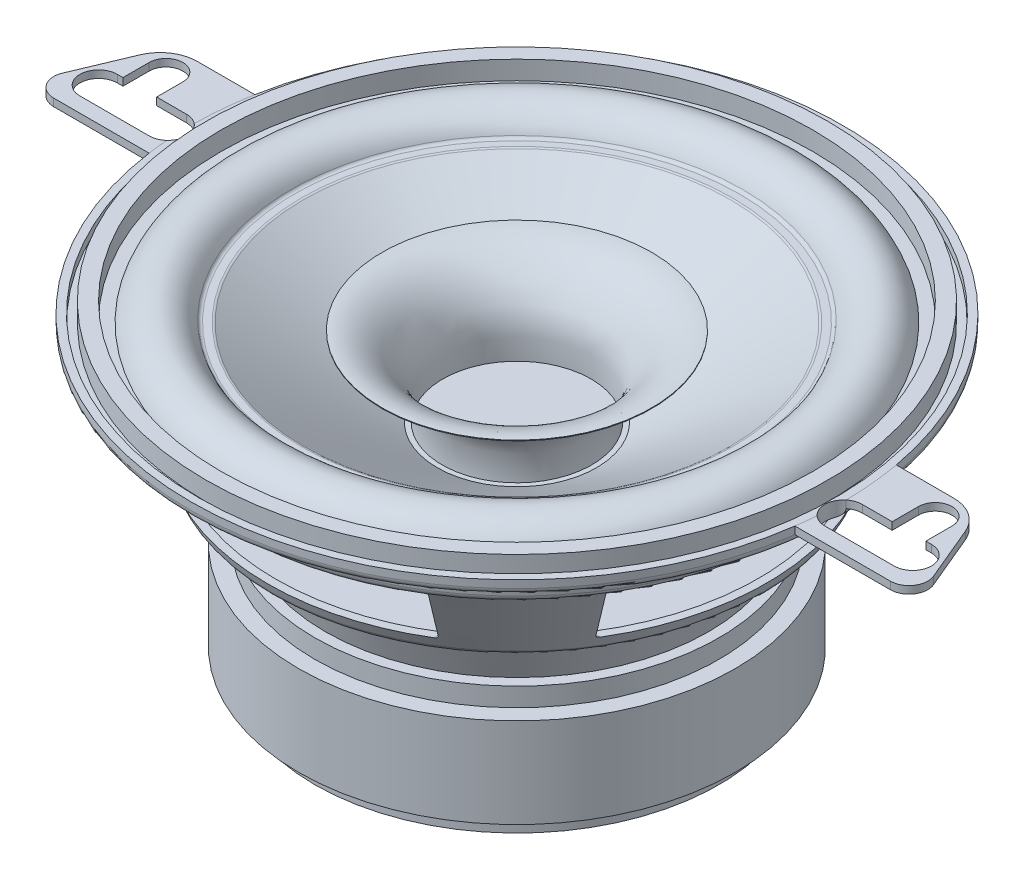
from build123d import *

# Parameters (mm, degrees)
SKETCH1_R                = 29.15
BOSS_EXTRUDE1_DEPTH      = 12
BOSS_EXTRUDE2_DEPTH      = 2.5
BOSS_EXTRUDE2_DEPTH_BACK = 14.5
SKETCH2_R                = 27
SKETCH3_R                = 25.6
SKETCH4_R                = 28
SKETCH5_R                = 32.5
SKETCH6_R                = 36.75
SKETCH7_R                = 38.25
SKETCH9_R                = 38.6
SKETCH10_R               = 43.5
SKETCH11_R               = 43.55
SHELL2_T                 = -1
SKETCH12_R               = 30
BOSS_EXTRUDE5_DEPTH      = 0.1
CUT_EXTRUDE1_DEPTH       = 73.632327686
CUT_EXTRUDE1_DEPTH_BACK  = 73.632327686
CUT_EXTRUDE2_DEPTH       = 73.632327686
CUT_EXTRUDE2_DEPTH_BACK  = 73.632327686
SKETCH15_R               = 12.5
BOSS_EXTRUDE6_DEPTH      = 3
SKETCH21_R               = 41.524687549
SKETCH21_R_2             = 39.524687549
BOSS_EXTRUDE7_DEPTH      = 2.5
FILLET2_R                = 1
FILLET3_R                = 0.5
FILLET4_R                = 0.5
BOSS_EXTRUDE9_DEPTH      = 1
BOSS_EXTRUDE9_2_DEPTH    = 1
CUT_EXTRUDE4_DEPTH       = 41


# Read off the part's stored shape, not the designer's step: Loft-Thin1, Revolve-Thin7
with BuildPart() as part:
    # Sketch1 → Boss-Extrude1 (new body)
    with BuildSketch(Plane(origin=(0, 0, 0), x_dir=(1, 0, 0), z_dir=(0, 1, 0))):
        with Locations(Location((0, 0, 0), (0, 0, 270))):
            Circle(SKETCH1_R)
    extrude(amount=BOSS_EXTRUDE1_DEPTH)

    # Sketch2 → Boss-Extrude2 (add, two sides: drawn at the far end of the back side and taken through both)
    with BuildSketch(Plane(origin=(0, 0, 0), x_dir=(-1, 0, 0), z_dir=(0, -1, 0)).offset(-BOSS_EXTRUDE2_DEPTH_BACK)):
        with Locations(Location((0, 0, 0), (0, 0, 90))):
            Circle(SKETCH2_R)
    extrude(amount=BOSS_EXTRUDE2_DEPTH + BOSS_EXTRUDE2_DEPTH_BACK)

    # Sketch3 → Loft2 section 0
    with BuildSketch(Plane(origin=(0, 14.5, 0), x_dir=(1, 0, 0), z_dir=(0, 1, 0))):
        Circle(SKETCH3_R)
    # Sketch4 → Loft2 section 1
    with BuildSketch(Plane(origin=(0, 22, 0), x_dir=(1, 0, 0), z_dir=(0, 1, 0))):
        Circle(SKETCH4_R)
    loft()

    # Sketch5 → Loft3 section 0
    with BuildSketch(Plane(origin=(0, 22, 0), x_dir=(1, 0, 0), z_dir=(0, 1, 0))):
        Circle(SKETCH5_R)
    # Sketch6 → Loft3 section 1
    with BuildSketch(Plane(origin=(0, 32, 0), x_dir=(1, 0, 0), z_dir=(0, 1, 0))):
        Circle(SKETCH6_R)
    loft()

    # Sketch7 → Loft5 section 0
    with BuildSketch(Plane(origin=(0, 32, 0), x_dir=(1, 0, 0), z_dir=(0, 1, 0))):
        Circle(SKETCH7_R)
    # Sketch9 → Loft5 section 1
    with BuildSketch(Plane(origin=(0, 36.5, 0), x_dir=(1, 0, 0), z_dir=(0, 1, 0))):
        Circle(SKETCH9_R)
    loft()

    # Sketch10 → Loft6 section 0
    with BuildSketch(Plane(origin=(0, 36.5, 0), x_dir=(1, 0, 0), z_dir=(0, 1, 0))):
        Circle(SKETCH10_R)
    # Sketch11 → Loft6 section 1
    with BuildSketch(Plane(origin=(0, 38.5, 0), x_dir=(1, 0, 0), z_dir=(0, 1, 0))):
        Circle(SKETCH11_R)
    loft()

    # Shell2
    shell2_openings = [part.faces().sort_by_distance(p)[0] for p in [
        (0, 38.5, 0),
    ]]
    offset(amount=SHELL2_T, openings=shell2_openings, kind=Kind.INTERSECTION)

    # Sketch12 → Boss-Extrude5 (add)
    with BuildSketch(Plane(origin=(0, 23, 0), x_dir=(1, 0, 0), z_dir=(0, 1, 0))):
        Circle(SKETCH12_R)
    extrude(amount=-BOSS_EXTRUDE5_DEPTH)

    # Sketch13 → Cut-Extrude1 (cut, two sides: drawn at the far end of the back side and taken through both)
    with BuildSketch(Plane.XY.offset(-CUT_EXTRUDE1_DEPTH_BACK)):
        Polygon((-19.249950175, 31.9), (19.250049825, 31.9), (17.75, 23.9), (-17.75, 23.9), align=None)
    extrude(amount=CUT_EXTRUDE1_DEPTH + CUT_EXTRUDE1_DEPTH_BACK, mode=Mode.SUBTRACT)

    # Sketch14 → Cut-Extrude2 (cut, two sides: drawn at the far end of the back side and taken through both)
    with BuildSketch(Plane(origin=(0, 0, 0), x_dir=(0, 0, -1), z_dir=(1, 0, 0)).offset(-CUT_EXTRUDE2_DEPTH_BACK)):
        Polygon((19.25, 32), (-19.25, 32), (-17.75, 23.992550499), (17.75, 23.992550499), align=None)
    extrude(amount=CUT_EXTRUDE2_DEPTH + CUT_EXTRUDE2_DEPTH_BACK, mode=Mode.SUBTRACT)

    # Sketch15 → Boss-Extrude6 (add)
    with BuildSketch(Plane(origin=(0, 23, 0), x_dir=(1, 0, 0), z_dir=(0, 1, 0))):
        with Locations(Location((0, 0, 0), (0, 0, 270))):
            Circle(SKETCH15_R)
    extrude(amount=BOSS_EXTRUDE6_DEPTH)

    # Loft-Thin1 outline → Loft-Thin1 (revolve)
    with BuildSketch(Plane.XY):
        Polygon((30.5, 37.5), (28.642607881, 37.5), (10.642607881, 26), (12.5, 26), align=None)
    revolve(axis=Axis((0, 0, 0), (0, 1, 0)))

    # Sketch20 → Revolve-Thin6 (revolve)
    with BuildSketch(Plane.XY, mode=Mode.PRIVATE) as revolve_thin6_sk:
        with BuildLine():
            Line((-38, 37.4), (-30, 37.4))
            ThreePointArc((-30, 37.4), (-34, 40.213859338), (-38, 37.4))
        make_face()
        with BuildLine():
            Line((-36.151213303, 38.4), (-31.848786697, 38.4))
            ThreePointArc((-31.848786697, 38.4), (-34, 39.213859338), (-36.151213303, 38.4))
        make_face(mode=Mode.SUBTRACT)
    revolve(revolve_thin6_sk.sketch.rotate(Axis((0, 0, 0), (0, 1, 0)), 90), axis=Axis((0, 0, 0), (0, 1, 0)))

    # Sketch21 → Boss-Extrude7 (add)
    with BuildSketch(Plane(origin=(0, 37.5, 0), x_dir=(1, 0, 0), z_dir=(0, 1, 0))):
        with Locations(Location((0, 0, 0), (0, 0, 270))):
            Circle(SKETCH21_R)
        with Locations(Location((0, 0, 0), (0, 0, 270))):
            Circle(SKETCH21_R_2, mode=Mode.SUBTRACT)
    extrude(amount=BOSS_EXTRUDE7_DEPTH)

    # Revolve-Thin7 outline → Revolve-Thin7 (revolve)
    with BuildSketch(Plane.XY):
        with BuildLine():
            Line((9.900002578, 26), (10, 26))
            add(Edge.make_bspline(
                [(10, 26), (9.999997357, 26.000033228), (9.979696301, 28.697563402), (10.344834904, 32.224034388), (14.21730858, 36.304403959), (17.337023546, 36.5)],
                knots=[0, 0, 0, 0, 0.092070554, 0.341498093, 0.956740448, 0.956740448, 0.956740448, 0.956740448], degree=3))
            Line((17.337023546, 36.5), (16.572693272, 36.5))
            add(Edge.make_bspline(
                [(9.900002578, 26), (9.899908304, 26.012548631), (9.899348237, 26.089593266), (9.898161356, 26.34489845), (9.897541657, 26.5302591), (9.897591072, 26.939692133), (9.89826009, 27.163713884), (9.902178573, 27.585720936), (9.905420042, 27.784839665), (9.930185733, 28.729445138), (9.977317516, 29.322446249), (10.131380394, 30.126403174), (10.196651744, 30.379981891), (10.36150456, 30.883390879), (10.46164346, 31.135262974), (10.817106934, 31.904413032), (11.125241489, 32.427659326), (12.22745905, 33.951606789), (13.199206623, 34.906845161), (15.018178688, 36.019293345), (15.778686052, 36.341128113), (16.572693272, 36.5)],
                knots=[0.002720303, 0.002720303, 0.002720303, 0.002720303, 0.03125, 0.03125, 0.0625, 0.0625, 0.09375, 0.09375, 0.125, 0.125, 0.25, 0.25, 0.3125, 0.3125, 0.375, 0.375, 0.5, 0.5, 0.75, 0.75, 0.907300699, 0.907300699, 0.907300699, 0.907300699], degree=3))
        make_face()
        with BuildLine():
            Line((16.572693272, 36.5), (17.337023546, 36.5))
            add(Edge.make_bspline(
                [(17.337023546, 36.5), (17.556380147, 36.51375295), (17.777537902, 36.514119108), (18, 36.5)],
                knots=[0.956740448, 0.956740448, 0.956740448, 0.956740448, 1, 1, 1, 1], degree=3))
            Line((18, 36.5), (18, 36.5997992))
            Line((18, 36.5997992), (17.330630327, 36.5997992))
            add(Edge.make_bspline(
                [(16.572693272, 36.5), (16.822282635, 36.549940016), (17.075182137, 36.583777582), (17.330630327, 36.5997992)],
                knots=[0.907300699, 0.907300699, 0.907300699, 0.907300699, 0.956746825, 0.956746825, 0.956746825, 0.956746825], degree=3))
        make_face()
        Polygon((18, 36.5997992), (18, 36.5), (18.006334003, 36.5997992), align=None)
        with BuildLine():
            Line((18, 36.5997992), (18.006334003, 36.5997992))
            add(Edge.make_bspline(
                [(18, 36.600197387), (18.002111209, 36.600065938), (18.004222544, 36.599933209), (18.006334003, 36.5997992)],
                knots=[0.999597402, 0.999597402, 0.999597402, 0.999597402, 1, 1, 1, 1], degree=3))
            Line((18, 36.600197387), (18, 36.5997992))
        make_face()
        with BuildLine():
            Line((17.330630327, 36.5997992), (18, 36.5997992))
            Line((18, 36.5997992), (18, 36.600197387))
            add(Edge.make_bspline(
                [(17.669483714, 36.610454275), (17.77927324, 36.610454278), (17.889464998, 36.607079563), (18, 36.600197387)],
                knots=[0.978518887, 0.978518887, 0.978518887, 0.978518887, 0.999597402, 0.999597402, 0.999597402, 0.999597402], degree=3))
            add(Edge.make_bspline(
                [(17.330630327, 36.5997992), (17.443108983, 36.60685382), (17.55608178, 36.610454272), (17.669483714, 36.610454275)],
                knots=[0.956746825, 0.956746825, 0.956746825, 0.956746825, 0.978518887, 0.978518887, 0.978518887, 0.978518887], degree=3))
        make_face()
    revolve(axis=Axis((0, 0, 0), (0, 1, 0)))

    # Fillet2
    fillet2_edges = [part.edges().sort_by_distance(p)[0] for p in [
        (-28, 22, 0),
        (-32.5, 22, 0),
        (-38.6, 36.5, 0),
        (-38.25, 32, 0),
        (-43.5, 36.5, 0),
    ]]
    fillet(fillet2_edges, radius=FILLET2_R)

    # Fillet3
    fillet3_edges = [part.edges().sort_by_distance(p)[0] for p in [
        (30.663455547, 32, 19.25),
        (-30.663455547, 32, 19.25),
        (30.663455547, 32, -19.25),
        (-30.663455547, 32, -19.25),
        (-27.584202046, 23.992550499, -17.75),
        (27.584202046, 23.992550499, -17.75),
        (-27.584202046, 23.992550499, 17.75),
        (27.584202046, 23.992550499, 17.75),
        (-19.249950175, 31.9, 30.613285978),
        (-19.249950175, 31.9, -30.613285978),
        (-17.75, 23.9, 27.537406311),
        (-17.75, 23.9, -27.537406311),
        (19.250049825, 31.9, -30.61322329),
        (19.250049825, 31.9, 30.61322329),
        (17.75, 23.9, -27.537406311),
        (17.75, 23.9, 27.537406311),
    ]]
    fillet(fillet3_edges, radius=FILLET3_R)

    # Fillet4
    fillet4_edges = [part.edges().sort_by_distance(p)[0] for p in [
        (-28.642607881, 37.5, 0),
        (0, 37.5, -30.037327686),
    ]]
    fillet(fillet4_edges, radius=FILLET4_R)


with BuildPart() as body_2:
    # Sketch25 → Boss-Extrude9 (new body)
    with BuildSketch(Plane(origin=(0, 38.5, 0), x_dir=(1, 0, 0), z_dir=(0, 1, 0))):
        with BuildLine():
            ThreePointArc((42.839367214, 7.835248352), (43.540081078, 0.929429803), (43.134701807, -6))
            Line((43.134701807, -6), (55.877029002, -6))
            ThreePointArc((55.877029002, -6), (57.958461531, -4.884788297), (58.182903727, -2.534110901))
            Line((58.182903727, -2.534110901), (55.124589676, 4.767026549))
            ThreePointArc((55.124589676, 4.767026549), (53.282416818, 6.99811341), (50.512840225, 7.835248352))
            Line((50.512840225, 7.835248352), (42.839367214, 7.835248352))
        make_face()
    extrude(amount=-BOSS_EXTRUDE9_DEPTH)


with BuildPart() as body_3:
    # Sketch25 → Boss-Extrude9 2 (new body)
    with BuildSketch(Plane(origin=(0, 38.5, 0), x_dir=(1, 0, 0), z_dir=(0, 1, 0))):
        with BuildLine():
            Line((-55.877029002, -6), (-43.134701807, -6))
            ThreePointArc((-43.134701807, -6), (-43.540081078, 0.929429803), (-42.839367214, 7.835248352))
            Line((-42.839367214, 7.835248352), (-50.512840225, 7.835248352))
            ThreePointArc((-50.512840225, 7.835248352), (-53.282416818, 6.99811341), (-55.124589676, 4.767026549))
            Line((-55.124589676, 4.767026549), (-58.182903727, -2.534110901))
            ThreePointArc((-58.182903727, -2.534110901), (-57.958461531, -4.884788297), (-55.877029002, -6))
        make_face()
    extrude(amount=-BOSS_EXTRUDE9_2_DEPTH)


with BuildPart() as cut_extrude4_tool:
    # Sketch28 → Cut-Extrude4 (new body)
    with BuildSketch(Plane(origin=(0, 38.5, 0), x_dir=(1, 0, 0), z_dir=(0, 1, 0))):
        with BuildLine():
            Line((-53.627029002, 1), (-49.127029002, 1))
            Line((-49.127029002, 1), (-49.127029002, 4.5))
            ThreePointArc((-49.127029002, 4.5), (-51.377029002, 6.75), (-53.627029002, 4.5))
            Line((-53.627029002, 4.5), (-53.627029002, 1))
        make_face()
        with BuildLine():
            ThreePointArc((-53.627029002, -1.5), (-51.377029002, -3.75), (-49.127029002, -1.5))
            Line((-49.127029002, -1.5), (-49.127029002, 1))
            Line((-49.127029002, 1), (-53.627029002, 1))
            Line((-53.627029002, 1), (-53.627029002, -1.5))
        make_face()
        with BuildLine():
            Line((-49.127029002, 1), (-49.127029002, -1.5))
            ThreePointArc((-49.127029002, -1.5), (-51.377029002, -3.75), (-53.627029002, -1.5))
            Line((-53.627029002, -1.5), (-53.627029002, 1))
            Line((-53.627029002, 1), (-54.377029002, 1))
            ThreePointArc((-54.377029002, 1), (-56.877029002, -1.5), (-54.377029002, -4))
            Line((-54.377029002, -4), (-45.127029002, -4))
            ThreePointArc((-45.127029002, -4), (-42.627029002, -1.5), (-45.127029002, 1))
            Line((-45.127029002, 1), (-49.127029002, 1))
        make_face()
        with BuildLine():
            Line((49.127029002, 4.5), (49.127029002, 1))
            Line((49.127029002, 1), (53.627029002, 1))
            Line((53.627029002, 1), (53.627029002, 4.5))
            ThreePointArc((53.627029002, 4.5), (51.377029002, 6.75), (49.127029002, 4.5))
        make_face()
        with BuildLine():
            Line((53.627029002, 1), (49.127029002, 1))
            Line((49.127029002, 1), (49.127029002, -1.5))
            ThreePointArc((49.127029002, -1.5), (51.377029002, -3.75), (53.627029002, -1.5))
            Line((53.627029002, -1.5), (53.627029002, 1))
        make_face()
        with BuildLine():
            Line((49.127029002, 1), (45.127029002, 1))
            ThreePointArc((45.127029002, 1), (44.28891128, 0.8553256), (43.5477969, 0.438046947))
            ThreePointArc((43.5477969, 0.438046947), (43.525961492, -1.446781312), (43.422585484, -3.328899203))
            ThreePointArc((43.422585484, -3.328899203), (44.211127262, -3.826182281), (45.127029002, -4))
            Line((45.127029002, -4), (54.377029002, -4))
            ThreePointArc((54.377029002, -4), (56.877029002, -1.5), (54.377029002, 1))
            Line((54.377029002, 1), (53.627029002, 1))
            Line((53.627029002, 1), (53.627029002, -1.5))
            ThreePointArc((53.627029002, -1.5), (51.377029002, -3.75), (49.127029002, -1.5))
            Line((49.127029002, -1.5), (49.127029002, 1))
        make_face()
        with BuildLine():
            ThreePointArc((43.422585484, -3.328899203), (43.525961492, -1.446781312), (43.5477969, 0.438046947))
            ThreePointArc((43.5477969, 0.438046947), (42.628408939, -1.416947112), (43.422585484, -3.328899203))
        make_face()
    extrude(amount=-CUT_EXTRUDE4_DEPTH)


with BuildPart() as part_1:
    add(part.part)

    # Cut-Extrude4: cut by cut_extrude4_tool
    add(cut_extrude4_tool.part, mode=Mode.SUBTRACT)


with BuildPart() as body_2_1:
    add(body_2.part)

    # Cut-Extrude4: cut by cut_extrude4_tool
    add(cut_extrude4_tool.part, mode=Mode.SUBTRACT)


with BuildPart() as body_3_1:
    add(body_3.part)

    # Cut-Extrude4: cut by cut_extrude4_tool
    add(cut_extrude4_tool.part, mode=Mode.SUBTRACT)


solid = Compound([part_1.part, body_2_1.part, body_3_1.part])
